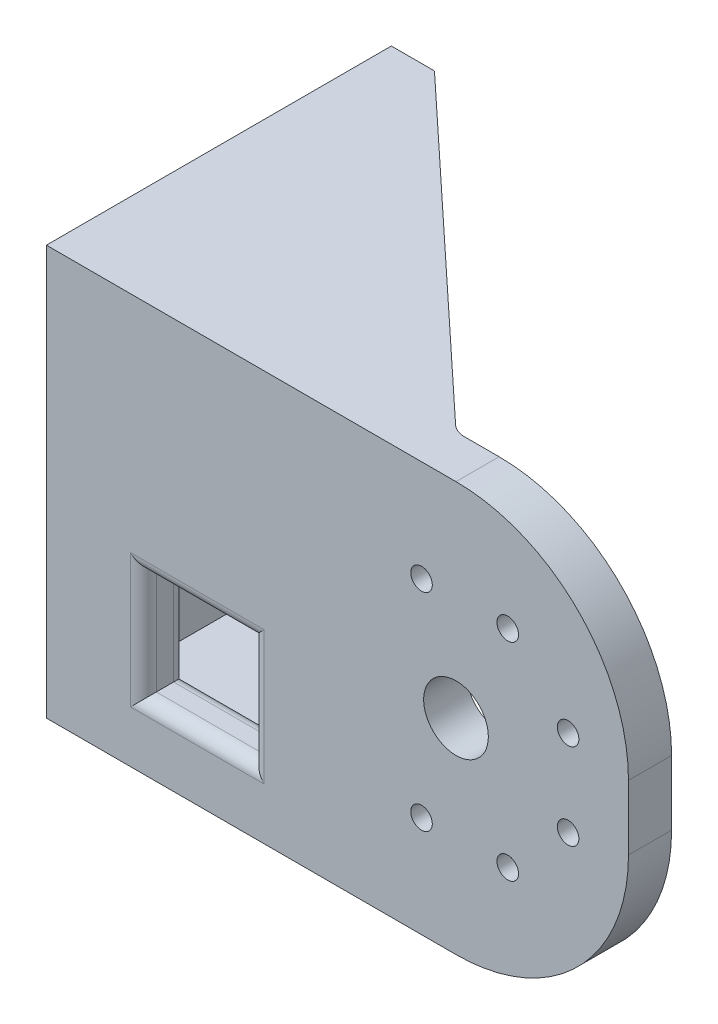
from build123d import *

# Parameters (mm, degrees)
SKETCH3_R           = 7.5
SKETCH3_R_2         = 2.5
BOSS_EXTRUDE1_DEPTH = 10
SKETCH4_W           = 10
SKETCH4_H           = 95
BOSS_EXTRUDE2_DEPTH = 70
SKETCH8_R           = 7.5
SKETCH8_R_2         = 2.5
CUT_EXTRUDE2_DEPTH  = 43.8
BOSS_EXTRUDE3_DEPTH = 10
FILLET1_R           = 5
SKETCH11_W          = 25
SKETCH11_H          = 25
CUT_EXTRUDE3_DEPTH  = 230.716194563
FILLET3_R           = 3


with BuildPart() as part:
    # Sketch3 → Boss-Extrude1 (new body)
    with BuildSketch(Plane.XY):
        with BuildLine():
            Line((68.617133813, 80.05993294), (163.617133813, 80.05993294))
            ThreePointArc((163.617133813, 80.05993294), (191.90140506, 68.344204188), (203.617133813, 40.05993294))
            Line((203.617133813, 40.05993294), (203.617133813, 25.05993294))
            ThreePointArc((203.617133813, 25.05993294), (191.90140506, -3.224338307), (163.617133813, -14.94006706))
            Line((163.617133813, -14.94006706), (68.617133813, -14.94006706))
            Line((68.617133813, -14.94006706), (68.617133813, 80.05993294))
        make_face()
        with Locations((163.617133813, 32.55993294)):
            Circle(SKETCH3_R, mode=Mode.SUBTRACT)
        with Locations((189.617133813, 42.55993294)):
            Circle(SKETCH3_R_2, mode=Mode.SUBTRACT)
        with Locations((155.617133813, 56.55993294)):
            Circle(SKETCH3_R_2, mode=Mode.SUBTRACT)
        with Locations((175.617133813, 56.55993294)):
            Circle(SKETCH3_R_2, mode=Mode.SUBTRACT)
        with Locations((155.617133813, 8.55993294)):
            Circle(SKETCH3_R_2, mode=Mode.SUBTRACT)
        with Locations((175.617133813, 8.55993294)):
            Circle(SKETCH3_R_2, mode=Mode.SUBTRACT)
        with Locations((189.617133813, 22.55993294)):
            Circle(SKETCH3_R_2, mode=Mode.SUBTRACT)
    extrude(amount=BOSS_EXTRUDE1_DEPTH)

    # Sketch4 → Boss-Extrude2 (add)
    with BuildSketch(Plane(origin=(0, 0, 0), x_dir=(-1, 0, 0), z_dir=(0, 0, -1))):
        with Locations((-73.617133813, 32.55993294)):
            Rectangle(SKETCH4_W, SKETCH4_H)
    extrude(amount=BOSS_EXTRUDE2_DEPTH)

    # Sketch8 → Cut-Extrude2 (cut)
    with BuildSketch(Plane.ZY.offset(-68.617133813)):
        with Locations((-40, 32.55993294)):
            Circle(SKETCH8_R)
        with Locations((-56.167891819, 25.862972874)):
            Circle(SKETCH8_R_2)
        with Locations((-56.167891819, 39.256893006)):
            Circle(SKETCH8_R_2)
        with Locations((-46.696960066, 48.727824759)):
            Circle(SKETCH8_R_2)
        with Locations((-33.303039934, 48.727824759)):
            Circle(SKETCH8_R_2)
        with Locations((-23.832108181, 39.256893006)):
            Circle(SKETCH8_R_2)
        with Locations((-23.832108181, 25.862972874)):
            Circle(SKETCH8_R_2)
        with Locations((-33.303039934, 16.392041121)):
            Circle(SKETCH8_R_2)
        with Locations((-46.696960066, 16.392041121)):
            Circle(SKETCH8_R_2)
    extrude(amount=-CUT_EXTRUDE2_DEPTH, mode=Mode.SUBTRACT)

    # Sketch9 → Boss-Extrude3 (add)
    with BuildSketch(Plane.XZ.offset(14.94006706)):
        Polygon((78.617133813, -70), (153.617133813, 0), (78.617133813, 0), align=None)
    boss_extrude3 = extrude(amount=-BOSS_EXTRUDE3_DEPTH)

    # Mirror1: Boss-Extrude3 across plane
    add(boss_extrude3.mirror(Plane(origin=(0, 32.55993294, 0), x_dir=(0, 0, 1), z_dir=(0, -1, 0))))

    # Fillet1
    fillet1_edges = [part.edges().sort_by_distance(p)[0] for p in [
        (153.617133813, 75.05993294, 0),
        (153.617133813, -9.94006706, 0),
    ]]
    fillet(fillet1_edges, radius=FILLET1_R)

    # Sketch11 → Cut-Extrude3 (cut, through all)
    with BuildSketch(Plane(origin=(0, 0, 0), x_dir=(-1, 0, 0), z_dir=(0, 0, -1))):
        with Locations((-103.617133813, 12.55993294)):
            Rectangle(SKETCH11_W, SKETCH11_H)
    extrude(amount=-CUT_EXTRUDE3_DEPTH, mode=Mode.SUBTRACT)

    # Fillet3
    fillet3_edges = [part.edges().sort_by_distance(p)[0] for p in [
        (116.117133813, 12.55993294, 0),
        (116.117133813, 12.55993294, 10),
        (103.617133813, 0.05993294, 10),
        (103.617133813, 0.05993294, 0),
        (91.117133813, 12.55993294, 10),
        (103.617133813, 25.05993294, 10),
        (103.617133813, 25.05993294, 0),
        (91.117133813, 12.55993294, 0),
    ]]
    fillet(fillet3_edges, radius=FILLET3_R)


solid = part.part
